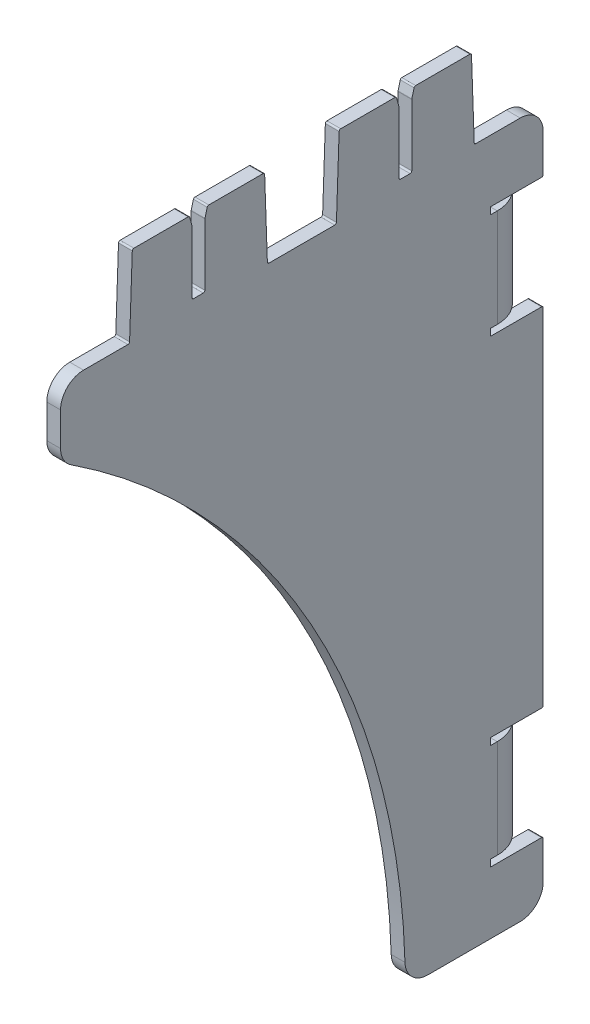
from build123d import *

# Parameters (mm, degrees)
BASE_FLANGE1_DEPTH   = 3
EDGE_FLANGE1_START   = 13.5
EDGE_FLANGE1_DEPTH   = 24.4
EDGE_FLANGE1_START_2 = 113.5
EDGE_FLANGE1_2_DEPTH = 24.4
EDGE_FLANGE1_3_DEPTH = 1.5
EDGE_FLANGE1_START_3 = 36.4
EDGE_FLANGE1_4_DEPTH = 1.5
EDGE_FLANGE1_5_DEPTH = 1.5
EDGE_FLANGE1_START_4 = 136.4
EDGE_FLANGE1_6_DEPTH = 1.5
EDGE_FLANGE1_START_5 = 15
EDGE_FLANGE1_7_DEPTH = 21.4
EDGE_FLANGE1_START_6 = 115
EDGE_FLANGE1_8_DEPTH = 21.4
SKETCH12_R           = 3
CUT_EXTRUDE1_DEPTH   = 199.562861583
CUT_EXTRUDE2_DEPTH   = 201.701793714
FILLET1_R            = 5


# Read off the part's stored shape, not the designer's step: Edge-Flange1
# Sheet-metal steps are written as plain solids
with BuildPart() as part:
    # Sketch1 → Base-Flange1 (new body)
    with BuildSketch(Plane(origin=(0, 0, 0), x_dir=(0, 0, -1), z_dir=(1, 0, 0))):
        with BuildLine():
            Line((-89.400682252, 168.562214824), (-89.988204282, 151.737785176))
            ThreePointArc((-89.988204282, 151.737785176), (-90.094860642, 151.49823107), (-90.337991071, 151.4))
            Line((-90.337991071, 151.4), (-104.65, 151.4))
            Line((-104.65, 151.4), (-105, 151.4))
            Line((-105, 151.4), (-105, 151.05))
            Line((-105, 151.05), (-105, 136.592313107))
            Line((-105, 136.592313107), (-105, 136.4))
            Line((-105, 136.4), (-104.837845918, 136.296993093))
            ThreePointArc((-104.837845918, 136.296993093), (-50.024333792, 77.898717236), (-30.000377542, 0.349243281))
            Line((-30.000377542, 0.349243281), (-30, 0))
            Line((-30, 0), (-29.65037836, 0))
            Line((-29.65037836, 0), (-0.35, 0))
            Line((-0.35, 0), (0, 0))
            Line((0, 0), (0, 0.35))
            Line((0, 0.35), (0, 14.65))
            ThreePointArc((0, 14.65), (-0.102512627, 14.897487373), (-0.35, 15))
            Line((-0.35, 15), (-2, 15))
            Line((-2, 15), (-2, 15.7))
            Line((-2, 15.7), (-2, 35.7))
            Line((-2, 35.7), (-2, 36.4))
            Line((-2, 36.4), (-0.35, 36.4))
            ThreePointArc((-0.35, 36.4), (-0.102512627, 36.502512627), (0, 36.75))
            Line((0, 36.75), (0, 114.65))
            ThreePointArc((0, 114.65), (-0.102512627, 114.897487373), (-0.35, 115))
            Line((-0.35, 115), (-2, 115))
            Line((-2, 115), (-2, 115.7))
            Line((-2, 115.7), (-2, 135.7))
            Line((-2, 135.7), (-2, 136.4))
            Line((-2, 136.4), (-0.35, 136.4))
            ThreePointArc((-0.35, 136.4), (-0.102512627, 136.502512627), (0, 136.75))
            Line((0, 136.75), (0, 151.05))
            Line((0, 151.05), (0, 151.4))
            Line((0, 151.4), (-0.35, 151.4))
            Line((-0.35, 151.4), (-14.662008929, 151.4))
            ThreePointArc((-14.662008929, 151.4), (-14.905139358, 151.49823107), (-15.011795718, 151.737785176))
            Line((-15.011795718, 151.737785176), (-15.599317748, 168.562214824))
            ThreePointArc((-15.599317748, 168.562214824), (-15.705974108, 168.80176893), (-15.949104537, 168.9))
            Line((-15.949104537, 168.9), (-27.756435554, 168.9))
            ThreePointArc((-27.756435554, 168.9), (-27.969502054, 168.827673669), (-28.094509593, 168.640586666))
            Line((-28.094509593, 168.640586666), (-28.588074039, 166.798579077))
            ThreePointArc((-28.588074039, 166.798579077), (-28.597005701, 166.753676579), (-28.6, 166.707992411))
            Line((-28.6, 166.707992411), (-28.6, 153.25))
            ThreePointArc((-28.6, 153.25), (-28.702512627, 153.002512627), (-28.95, 152.9))
            Line((-28.95, 152.9), (-31.05, 152.9))
            ThreePointArc((-31.05, 152.9), (-31.297487373, 153.002512627), (-31.4, 153.25))
            Line((-31.4, 153.25), (-31.4, 166.707992411))
            ThreePointArc((-31.4, 166.707992411), (-31.402994299, 166.753676579), (-31.411925961, 166.798579077))
            Line((-31.411925961, 166.798579077), (-31.905490407, 168.640586666))
            ThreePointArc((-31.905490407, 168.640586666), (-32.030497946, 168.827673669), (-32.243564446, 168.9))
            Line((-32.243564446, 168.9), (-44.050895463, 168.9))
            ThreePointArc((-44.050895463, 168.9), (-44.294025892, 168.80176893), (-44.400682252, 168.562214824))
            Line((-44.400682252, 168.562214824), (-44.988204282, 151.737785176))
            ThreePointArc((-44.988204282, 151.737785176), (-45.094860642, 151.49823107), (-45.337991071, 151.4))
            Line((-45.337991071, 151.4), (-59.662008929, 151.4))
            ThreePointArc((-59.662008929, 151.4), (-59.905139358, 151.49823107), (-60.011795718, 151.737785176))
            Line((-60.011795718, 151.737785176), (-60.599317748, 168.562214824))
            ThreePointArc((-60.599317748, 168.562214824), (-60.705974108, 168.80176893), (-60.949104537, 168.9))
            Line((-60.949104537, 168.9), (-72.756435554, 168.9))
            ThreePointArc((-72.756435554, 168.9), (-72.969502054, 168.827673669), (-73.094509593, 168.640586666))
            Line((-73.094509593, 168.640586666), (-73.588074039, 166.798579077))
            ThreePointArc((-73.588074039, 166.798579077), (-73.597005701, 166.753676579), (-73.6, 166.707992411))
            Line((-73.6, 166.707992411), (-73.6, 153.25))
            ThreePointArc((-73.6, 153.25), (-73.702512627, 153.002512627), (-73.95, 152.9))
            Line((-73.95, 152.9), (-76.05, 152.9))
            ThreePointArc((-76.05, 152.9), (-76.297487373, 153.002512627), (-76.4, 153.25))
            Line((-76.4, 153.25), (-76.4, 166.707992411))
            ThreePointArc((-76.4, 166.707992411), (-76.402994299, 166.753676579), (-76.411925961, 166.798579077))
            Line((-76.411925961, 166.798579077), (-76.905490407, 168.640586666))
            ThreePointArc((-76.905490407, 168.640586666), (-77.030497946, 168.827673669), (-77.243564446, 168.9))
            Line((-77.243564446, 168.9), (-89.050895463, 168.9))
            ThreePointArc((-89.050895463, 168.9), (-89.294025892, 168.80176893), (-89.400682252, 168.562214824))
        make_face()
    extrude(amount=-BASE_FLANGE1_DEPTH)

    # Edge-Flange1 outline → Edge-Flange1 (cut)
    with BuildSketch(Plane(origin=(0, 0, 0), x_dir=(1, 0, 0), z_dir=(0, 1, 0)).offset(EDGE_FLANGE1_START)):
        with BuildLine():
            Line((0, -2), (-3, -2))
            Line((-3, -2), (-3, -3.755002002))
            ThreePointArc((-3, -3.755002002), (-0.788897449, -6.535898385), (0, -10))
            Line((0, -10), (0, -2))
        make_face()
    extrude(amount=EDGE_FLANGE1_DEPTH, mode=Mode.SUBTRACT)

    # Edge-Flange1 2 outline → Edge-Flange1 2 (cut)
    with BuildSketch(Plane(origin=(0, 0, 0), x_dir=(1, 0, 0), z_dir=(0, 1, 0)).offset(EDGE_FLANGE1_START_2)):
        with BuildLine():
            Line((0, -2), (-3, -2))
            Line((-3, -2), (-3, -3.755002002))
            ThreePointArc((-3, -3.755002002), (-0.788897449, -6.535898385), (0, -10))
            Line((0, -10), (0, -2))
        make_face()
    extrude(amount=EDGE_FLANGE1_2_DEPTH, mode=Mode.SUBTRACT)

    # Edge-Flange1 3 outline → Edge-Flange1 3 (cut)
    with BuildSketch(Plane(origin=(0, 0, 0), x_dir=(1, 0, 0), z_dir=(0, 1, 0)).offset(EDGE_FLANGE1_START)):
        with BuildLine():
            ThreePointArc((0, -10), (-0.788897449, -6.535898385), (-3, -3.755002002))
            Line((-3, -3.755002002), (-3, -11.5))
            Line((-3, -11.5), (0, -11.5))
            Line((0, -11.5), (0, -10))
        make_face()
    extrude(amount=EDGE_FLANGE1_3_DEPTH, mode=Mode.SUBTRACT)

    # Edge-Flange1 4 outline → Edge-Flange1 4 (cut)
    with BuildSketch(Plane(origin=(0, 0, 0), x_dir=(1, 0, 0), z_dir=(0, 1, 0)).offset(EDGE_FLANGE1_START_3)):
        with BuildLine():
            ThreePointArc((0, -10), (-0.788897449, -6.535898385), (-3, -3.755002002))
            Line((-3, -3.755002002), (-3, -11.5))
            Line((-3, -11.5), (0, -11.5))
            Line((0, -11.5), (0, -10))
        make_face()
    extrude(amount=EDGE_FLANGE1_4_DEPTH, mode=Mode.SUBTRACT)

    # Edge-Flange1 5 outline → Edge-Flange1 5 (cut)
    with BuildSketch(Plane(origin=(0, 0, 0), x_dir=(1, 0, 0), z_dir=(0, 1, 0)).offset(EDGE_FLANGE1_START_2)):
        with BuildLine():
            ThreePointArc((0, -10), (-0.788897449, -6.535898385), (-3, -3.755002002))
            Line((-3, -3.755002002), (-3, -11.5))
            Line((-3, -11.5), (0, -11.5))
            Line((0, -11.5), (0, -10))
        make_face()
    extrude(amount=EDGE_FLANGE1_5_DEPTH, mode=Mode.SUBTRACT)

    # Edge-Flange1 6 outline → Edge-Flange1 6 (cut)
    with BuildSketch(Plane(origin=(0, 0, 0), x_dir=(1, 0, 0), z_dir=(0, 1, 0)).offset(EDGE_FLANGE1_START_4)):
        with BuildLine():
            ThreePointArc((0, -10), (-0.788897449, -6.535898385), (-3, -3.755002002))
            Line((-3, -3.755002002), (-3, -11.5))
            Line((-3, -11.5), (0, -11.5))
            Line((0, -11.5), (0, -10))
        make_face()
    extrude(amount=EDGE_FLANGE1_6_DEPTH, mode=Mode.SUBTRACT)

    # Edge-Flange1 7 outline → Edge-Flange1 7 (add)
    with BuildSketch(Plane(origin=(0, 0, 0), x_dir=(1, 0, 0), z_dir=(0, 1, 0)).offset(EDGE_FLANGE1_START_5)):
        with BuildLine():
            Line((-3, -10), (-3, -3.755002002))
            ThreePointArc((-3, -3.755002002), (-5.350470229, -2.451490744), (-8, -2))
            Line((-8, -2), (-30, -2))
            Line((-30, -2), (-30, -5))
            Line((-30, -5), (-8, -5))
            ThreePointArc((-8, -5), (-4.464466094, -6.464466094), (-3, -10))
        make_face()
    extrude(amount=EDGE_FLANGE1_7_DEPTH)

    # Edge-Flange1 8 outline → Edge-Flange1 8 (add)
    with BuildSketch(Plane(origin=(0, 0, 0), x_dir=(1, 0, 0), z_dir=(0, 1, 0)).offset(EDGE_FLANGE1_START_6)):
        with BuildLine():
            Line((-3, -10), (-3, -3.755002002))
            ThreePointArc((-3, -3.755002002), (-5.350470229, -2.451490744), (-8, -2))
            Line((-8, -2), (-30, -2))
            Line((-30, -2), (-30, -5))
            Line((-30, -5), (-8, -5))
            ThreePointArc((-8, -5), (-4.464466094, -6.464466094), (-3, -10))
        make_face()
    extrude(amount=EDGE_FLANGE1_8_DEPTH)

    # Sketch12 → Cut-Extrude1 (cut, through all)
    with BuildSketch(Plane.XY.offset(5)):
        with Locations((-19, 125.7)):
            Circle(SKETCH12_R)
        with Locations((-19, 25.7)):
            Circle(SKETCH12_R)
    extrude(amount=-CUT_EXTRUDE1_DEPTH, mode=Mode.SUBTRACT)

    # Sketch14 → Cut-Extrude2 (cut, through all)
    with BuildSketch(Plane.ZY.offset(3)):
        with BuildLine():
            Line((2, 136.4), (0, 136.4))
            Line((0, 136.4), (0, 137.9))
            Line((0, 137.9), (0, 138.25))
            ThreePointArc((0, 138.25), (0.102512627, 138.002512627), (0.35, 137.9))
            Line((0.35, 137.9), (2, 137.9))
            Line((2, 137.9), (2, 136.4))
        make_face()
        with BuildLine():
            Line((2, 115), (0, 115))
            Line((0, 115), (0, 113.5))
            Line((0, 113.5), (0, 113.15))
            ThreePointArc((0, 113.15), (0.102512627, 113.397487373), (0.35, 113.5))
            Line((0.35, 113.5), (2, 113.5))
            Line((2, 113.5), (2, 115))
        make_face()
        with BuildLine():
            Line((2, 36.4), (0, 36.4))
            Line((0, 36.4), (0, 37.9))
            Line((0, 37.9), (0, 38.25))
            ThreePointArc((0, 38.25), (0.102512627, 38.002512627), (0.35, 37.9))
            Line((0.35, 37.9), (2, 37.9))
            Line((2, 37.9), (2, 36.4))
        make_face()
        with BuildLine():
            Line((2, 13.5), (2, 15))
            Line((2, 15), (0, 15))
            Line((0, 15), (0, 13.5))
            Line((0, 13.5), (0, 13.15))
            ThreePointArc((0, 13.15), (0.102512627, 13.397487373), (0.35, 13.5))
            Line((0.35, 13.5), (2, 13.5))
        make_face()
    extrude(amount=-CUT_EXTRUDE2_DEPTH, mode=Mode.SUBTRACT)

    # Fillet1
    fillet1_edges = [part.edges().sort_by_distance(p)[0] for p in [
        (-1.5, 136.4, 105),
        (-1.5, 151.4, 105),
        (-1.5, 151.4, 0),
        (-30, 115, 3.5),
        (-30, 136.4, 3.5),
        (-30, 36.4, 3.5),
        (-30, 15, 3.5),
        (-1.5, 0, 30),
        (-1.5, 0, 0),
    ]]
    fillet(fillet1_edges, radius=FILLET1_R)


solid = part.part
